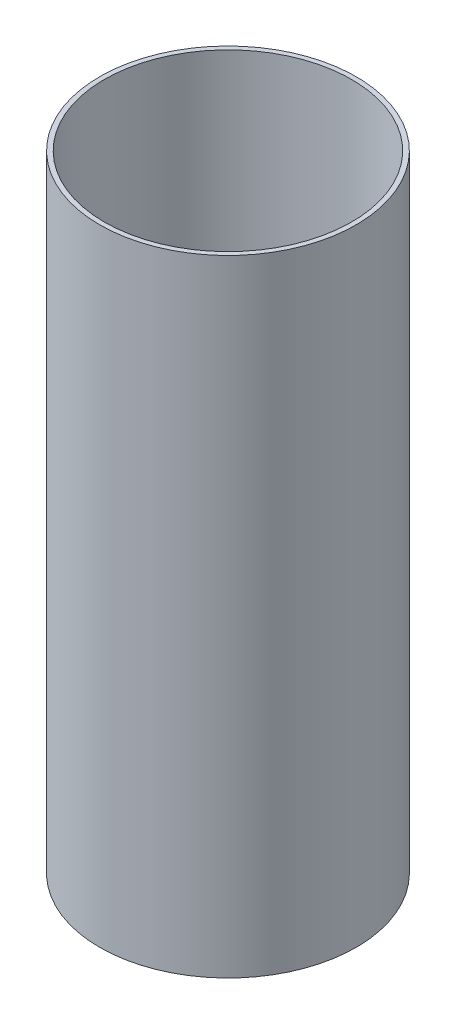
from build123d import *

# Parameters (mm, degrees)
SKETCH1_R           = 41
SKETCH1_R_2         = 39.5
BOSS_EXTRUDE1_DEPTH = 200


with BuildPart() as part:
    # Sketch1 → Boss-Extrude1 (new body)
    with BuildSketch(Plane(origin=(0, 0, 0), x_dir=(1, 0, 0), z_dir=(0, 1, 0))):
        Circle(SKETCH1_R)
        Circle(SKETCH1_R_2, mode=Mode.SUBTRACT)
    extrude(amount=BOSS_EXTRUDE1_DEPTH)


solid = part.part
